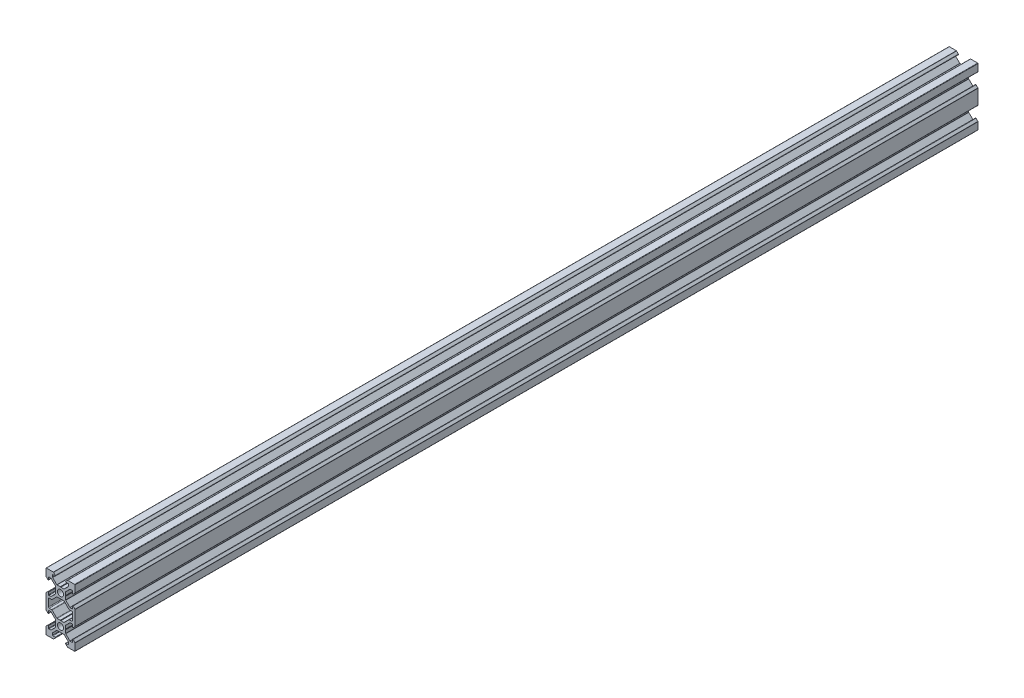
from build123d import *

# Parameters (mm, degrees)
SKETCH1_R           = 2.1
BOSS_EXTRUDE1_DEPTH = 622.69
FILLET1_R           = 0.25
FILLET2_R           = 0.5
CUT_EXTRUDE1_DEPTH  = 624.492450716


with BuildPart() as part:
    # Sketch1 → Boss-Extrude1 (new body)
    with BuildSketch(Plane.XY):
        Polygon((3.560660172, -2.5), (3.560660172, 2.5), (6.560660172, 5.5), (8.252142372, 5.5), (8.252142372, 3.1), (10, 4.847857628), (10, 10), (4.847857628, 10), (3.1, 8.252142372), (5.5, 8.252142372), (5.5, 6.560660172), (2.5, 3.560660172), (-2.5, 3.560660172), (-5.5, 6.560660172), (-5.5, 8.252142372), (-3.1, 8.252142372), (-4.847857628, 10), (-10, 10), (-10, 4.847857628), (-8.252142372, 3.1), (-8.252142372, 5.5), (-6.560660172, 5.5), (-3.560660172, 2.5), (-3.560660172, -2.5), (-6.560660172, -5.5), (-8.252142372, -5.5), (-8.252142372, -3.1), (-10, -4.847857628), (-10, -7), (-10, -13), (-10, -15.152142372), (-8.252142372, -16.9), (-8.252142372, -14.5), (-6.560660172, -14.5), (-3.560660172, -17.5), (-3.560660172, -22.5), (-6.560660172, -25.5), (-8.252142372, -25.5), (-8.252142372, -23.1), (-10, -24.847857628), (-10, -30), (-4.847857628, -30), (-3.1, -28.252142372), (-5.5, -28.252142372), (-5.5, -26.560660172), (-2.5, -23.560660172), (2.5, -23.560660172), (5.5, -26.560660172), (5.5, -28.252142372), (3.1, -28.252142372), (4.847857628, -30), (10, -30), (10, -24.847857628), (8.252142372, -23.1), (8.252142372, -25.5), (6.560660172, -25.5), (3.560660172, -22.5), (3.560660172, -17.5), (6.560660172, -14.5), (8.252142372, -14.5), (8.252142372, -16.9), (10, -15.152142372), (10, -13), (10, -7), (10, -4.847857628), (8.252142372, -3.1), (8.252142372, -5.5), (6.560660172, -5.5), align=None)
        Circle(SKETCH1_R, mode=Mode.SUBTRACT)
        with Locations((0, -20)):
            Circle(SKETCH1_R, mode=Mode.SUBTRACT)
        Polygon((2.5, -3.560660172), (-2.5, -3.560660172), (-5.5, -6.560660172), (-5.939339828, -7), (-8.252142372, -7), (-8.252142372, -13), (-5.939339828, -13), (-5.5, -13.439339828), (-2.5, -16.439339828), (2.5, -16.439339828), (5.5, -13.439339828), (5.939339828, -13), (8.252142372, -13), (8.252142372, -7), (5.939339828, -7), (5.5, -6.560660172), align=None, mode=Mode.SUBTRACT)
    extrude(amount=BOSS_EXTRUDE1_DEPTH)

    # Fillet1
    fillet1_edges = [part.edges().sort_by_distance(p)[0] for p in [
        (5.5, 6.560660172, 311.345),
        (5.5, 8.252142372, 311.345),
        (3.1, 8.252142372, 311.345),
        (4.847857628, 10, 311.345),
        (10, 10, 311.345),
        (10, 4.847857628, 311.345),
        (8.252142372, 3.1, 311.345),
        (8.252142372, 5.5, 311.345),
        (6.560660172, 5.5, 311.345),
        (3.560660172, 2.5, 311.345),
        (3.560660172, -2.5, 311.345),
        (6.560660172, -5.5, 311.345),
        (8.252142372, -5.5, 311.345),
        (8.252142372, -3.1, 311.345),
        (10, -4.847857628, 311.345),
        (10, -15.152142372, 311.345),
        (8.252142372, -16.9, 311.345),
        (8.252142372, -14.5, 311.345),
        (6.560660172, -14.5, 311.345),
        (3.560660172, -17.5, 311.345),
        (3.560660172, -22.5, 311.345),
        (6.560660172, -25.5, 311.345),
        (8.252142372, -25.5, 311.345),
        (8.252142372, -23.1, 311.345),
        (10, -24.847857628, 311.345),
        (10, -30, 311.345),
        (4.847857628, -30, 311.345),
        (3.1, -28.252142372, 311.345),
        (5.5, -28.252142372, 311.345),
        (5.5, -26.560660172, 311.345),
        (2.5, -23.560660172, 311.345),
        (-2.5, -23.560660172, 311.345),
        (-5.5, -26.560660172, 311.345),
        (-5.5, -28.252142372, 311.345),
        (-3.1, -28.252142372, 311.345),
        (-4.847857628, -30, 311.345),
        (-10, -30, 311.345),
        (-10, -24.847857628, 311.345),
        (-8.252142372, -23.1, 311.345),
        (-8.252142372, -25.5, 311.345),
        (-6.560660172, -25.5, 311.345),
        (-3.560660172, -22.5, 311.345),
        (-3.560660172, -17.5, 311.345),
        (-6.560660172, -14.5, 311.345),
        (-8.252142372, -14.5, 311.345),
        (-8.252142372, -16.9, 311.345),
        (-10, -15.152142372, 311.345),
        (-10, -4.847857628, 311.345),
        (-8.252142372, -3.1, 311.345),
        (-8.252142372, -5.5, 311.345),
        (-6.560660172, -5.5, 311.345),
        (-3.560660172, -2.5, 311.345),
        (-3.560660172, 2.5, 311.345),
        (-6.560660172, 5.5, 311.345),
        (-8.252142372, 5.5, 311.345),
        (-8.252142372, 3.1, 311.345),
        (-10, 4.847857628, 311.345),
        (-10, 10, 311.345),
        (-4.847857628, 10, 311.345),
        (-5.5, 8.252142372, 311.345),
        (-5.5, 6.560660172, 311.345),
        (-2.5, 3.560660172, 311.345),
        (2.5, 3.560660172, 311.345),
        (-3.1, 8.252142372, 311.345),
    ]]
    fillet(fillet1_edges, radius=FILLET1_R)

    # Fillet2
    fillet2_edges = [part.edges().sort_by_distance(p)[0] for p in [
        (-5.939339828, -7, 311.345),
        (-8.252142372, -7, 311.345),
        (-8.252142372, -13, 311.345),
        (-5.939339828, -13, 311.345),
        (-2.5, -16.439339828, 311.345),
        (2.5, -16.439339828, 311.345),
        (8.252142372, -7, 311.345),
        (5.939339828, -7, 311.345),
        (2.5, -3.560660172, 311.345),
        (-2.5, -3.560660172, 311.345),
        (5.939339828, -13, 311.345),
        (8.252142372, -13, 311.345),
    ]]
    fillet(fillet2_edges, radius=FILLET2_R)

    # Sketch2 → Cut-Extrude1 (cut, through all)
    with BuildSketch(Plane.XY.offset(622.69)):
        Polygon((0, 3.398953432), (-0.242280927, 3.560660172), (0.242280927, 3.560660172), align=None)
        Polygon((0, -3.398953432), (0.242280927, -3.560660172), (-0.242280927, -3.560660172), align=None)
        Polygon((3.560660172, 0.242280927), (3.560660172, -0.242280927), (3.398953432, 0), align=None)
        Polygon((-3.560660172, 0.242280927), (-3.560660172, -0.242280927), (-3.398953432, 0), align=None)
        Polygon((-3.398953432, -20), (-3.560660172, -20.242280927), (-3.560660172, -19.757719073), align=None)
        Polygon((3.398953432, -20), (3.560660172, -19.757719073), (3.560660172, -20.242280927), align=None)
        Polygon((-0.242280927, -16.439339828), (0.242280927, -16.439339828), (0, -16.601046568), align=None)
        Polygon((-0.242280927, -23.560660172), (0.242280927, -23.560660172), (0, -23.398953432), align=None)
    extrude(amount=-CUT_EXTRUDE1_DEPTH, mode=Mode.SUBTRACT)


solid = part.part
